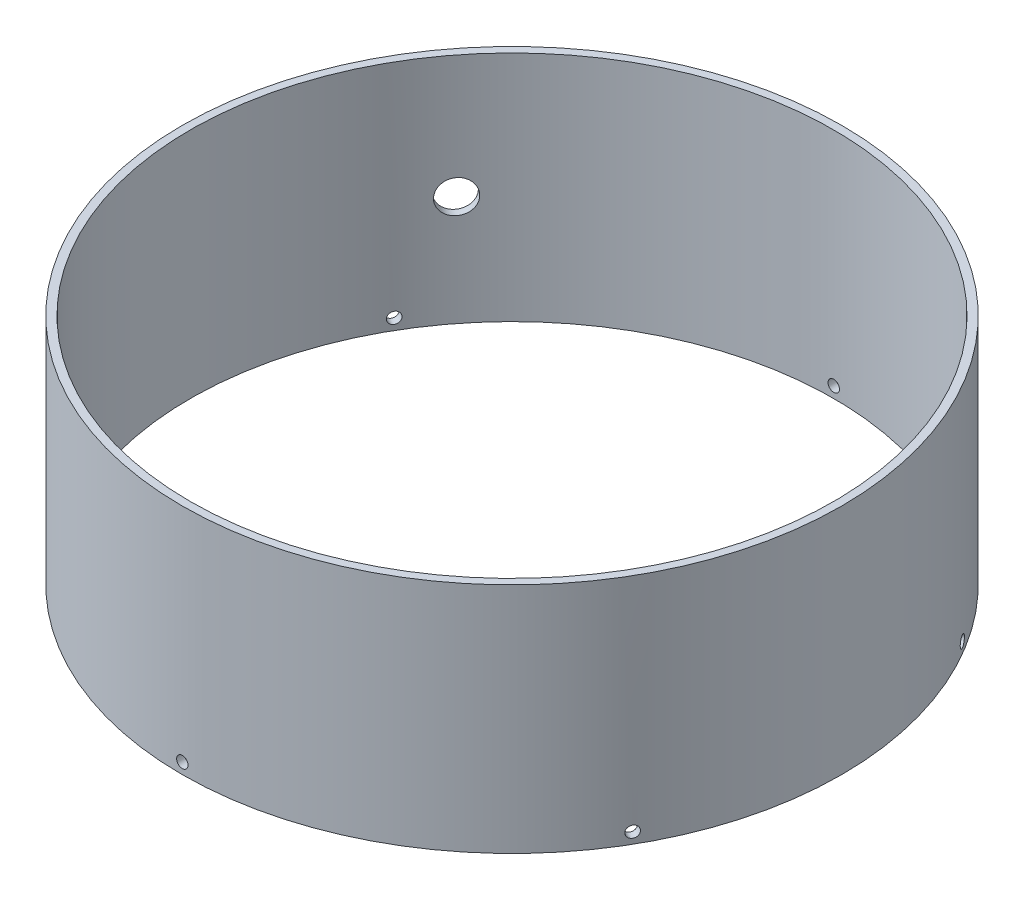
from build123d import *

# Parameters (mm, degrees)
SKETCH2_R               = 76.2
SKETCH2_R_2             = 74.3712
BOSS_EXTRUDE1_DEPTH     = 53.7718
CUT_EXTRUDE1_REACH      = 122.434
CUT_EXTRUDE1_END_RADIUS = 76.2
SKETCH3_R               = 1.3208
CIRPATTERN1_COUNT       = 6
SKETCH5_R               = 3.81
CUT_EXTRUDE2_DEPTH      = 121.433743264


with BuildPart() as part:
    # Sketch2 → Boss-Extrude1 (new body)
    with BuildSketch(Plane(origin=(0, 0, 0), x_dir=(1, 0, 0), z_dir=(0, 1, 0))):
        Circle(SKETCH2_R)
        Circle(SKETCH2_R_2, mode=Mode.SUBTRACT)
    extrude(amount=BOSS_EXTRUDE1_DEPTH)

    # Cut-Extrude1: up to this cylinder (the profile starts inside it)
    cut_extrude1_end = Plane(origin=(0, 2.54, 0), z_dir=(0, -1, 0)) * Cylinder(CUT_EXTRUDE1_END_RADIUS, 398.268, mode=Mode.PRIVATE)
    # Sketch3 → Cut-Extrude1 (cut, up to the surface)
    with BuildSketch(Plane.XY, mode=Mode.PRIVATE) as cut_extrude1_sk1:
        with Locations((0, 2.54)):
            Circle(SKETCH3_R)
    cut_extrude1_tool1 = extrude(cut_extrude1_sk1.sketch, amount=CUT_EXTRUDE1_REACH, mode=Mode.PRIVATE) & cut_extrude1_end
    cut_extrude1 = cut_extrude1_tool1.solids().sort_by_distance((0, 2.54, 0))[0]
    add(cut_extrude1, mode=Mode.SUBTRACT)

    # CirPattern1: Cut-Extrude1 ×6 about axis
    cirpattern1_axis = Axis((0, 53.7718, 0), (0, -1, 0))
    for i in range(1, CIRPATTERN1_COUNT):
        add(cut_extrude1.rotate(cirpattern1_axis, i * 360 / CIRPATTERN1_COUNT), mode=Mode.SUBTRACT)

    # Sketch5 → Cut-Extrude2 (cut, through all)
    with BuildSketch(Plane(origin=(0, 0, 0), x_dir=(-0.6156614753256536, 0, 0.7880107536067257), z_dir=(-0.7880107536067257, 0, -0.6156614753256536))):
        with Locations((0, 25.4)):
            Circle(SKETCH5_R)
    extrude(amount=CUT_EXTRUDE2_DEPTH, mode=Mode.SUBTRACT)


solid = part.part
